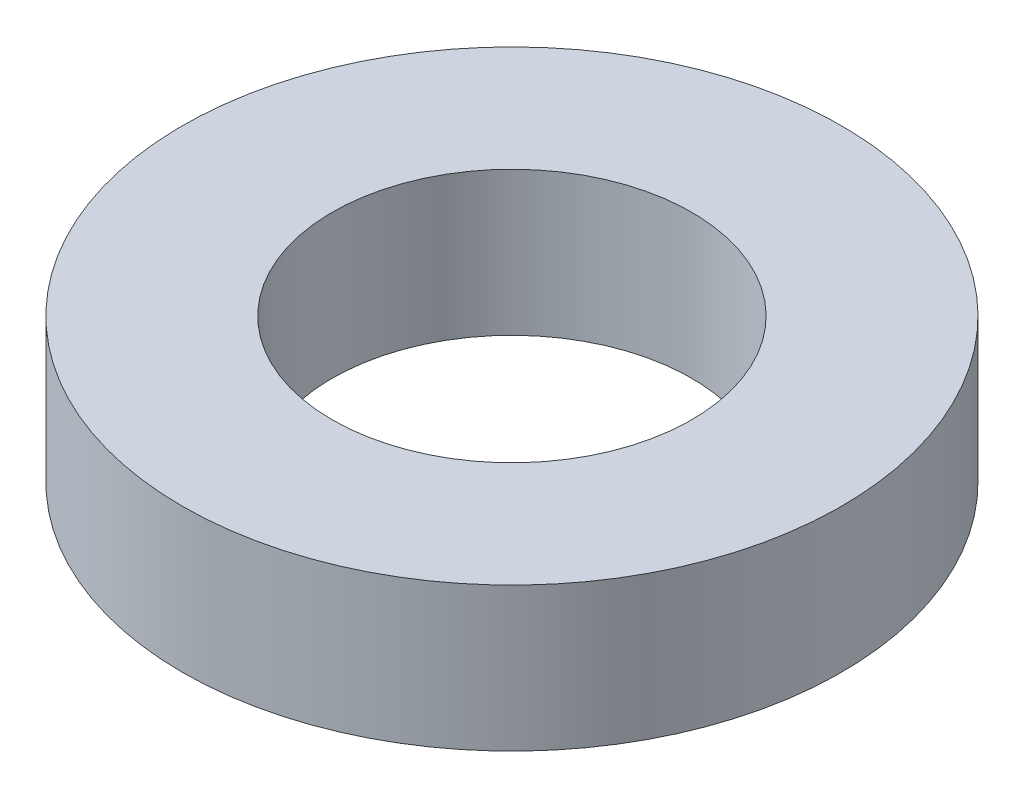
from build123d import *

# Parameters (mm, degrees)
SKETCH1_R           = 55
BOSS_EXTRUDE1_DEPTH = 24
SKETCH2_R           = 30
CUT_EXTRUDE1_DEPTH  = 82.4002457


with BuildPart() as part:
    # Sketch1 → Boss-Extrude1 (new body)
    with BuildSketch(Plane(origin=(0, 0, 0), x_dir=(1, 0, 0), z_dir=(0, 1, 0))):
        Circle(SKETCH1_R)
    extrude(amount=BOSS_EXTRUDE1_DEPTH)

    # Sketch2 → Cut-Extrude1 (cut, through all)
    with BuildSketch(Plane(origin=(0, 0, 0), x_dir=(1, 0, 0), z_dir=(0, 1, 0))):
        Circle(SKETCH2_R)
    extrude(amount=CUT_EXTRUDE1_DEPTH, mode=Mode.SUBTRACT)


solid = part.part
